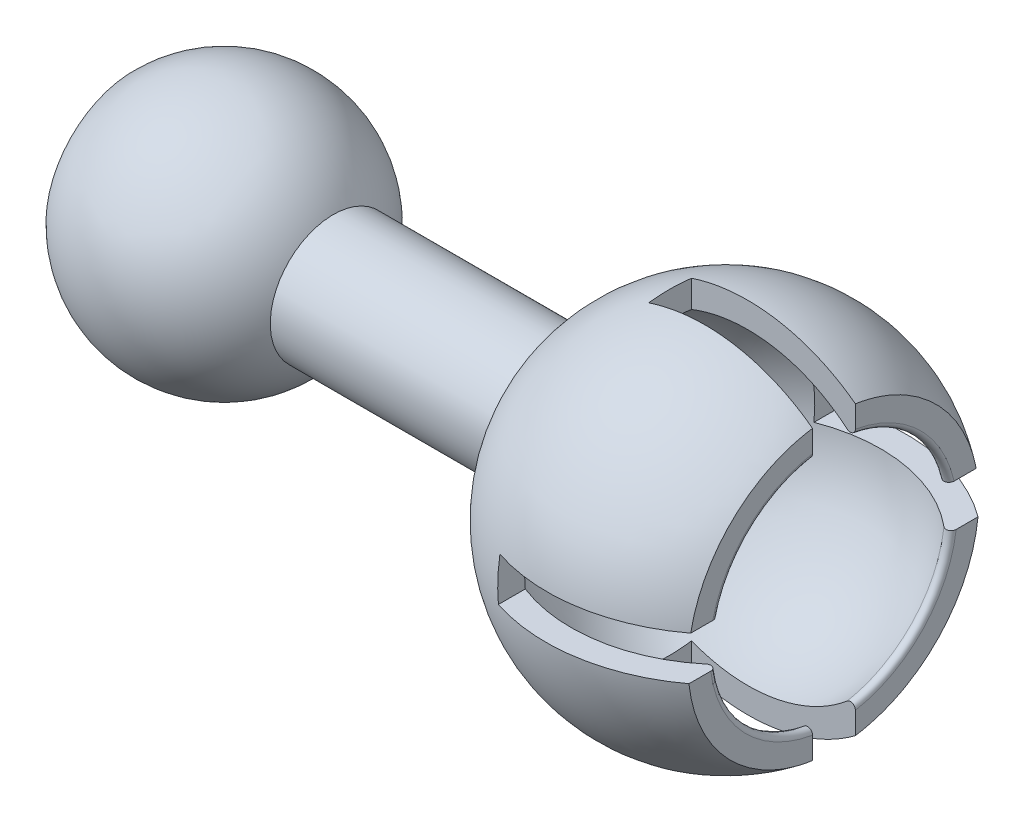
from build123d import *
from build123d.topology import SkipClean

# Parameters (mm, degrees)
SKETCH1_R           = 2.5
BOSS_EXTRUDE1_DEPTH = 9.1
SKETCH3_W           = 6
SKETCH3_H           = 11.05179945
CUT_EXTRUDE1_DEPTH  = 12.603447763
SKETCH5_W           = 2.612485444
SKETCH5_H           = 8.6
CUT_EXTRUDE2_DEPTH  = 12.603447763
SKETCH7_W           = 6.058370448
SKETCH7_H           = 19.821027014
CUT_EXTRUDE3_DEPTH  = 26.087084683
SKETCH8_W           = 5.087357921
SKETCH8_H           = 11.986300625
CUT_EXTRUDE4_DEPTH  = 26.087084683
SKETCH13_W          = 6.5
SKETCH13_H          = 1.7
CUT_EXTRUDE7_DEPTH  = 23.46963891
SKETCH14_W          = 6.5
SKETCH14_H          = 1.7
CUT_EXTRUDE12_DEPTH = 23.453824629
SKETCH15_W          = 6.5
SKETCH15_H          = 1.7
CUT_EXTRUDE13_DEPTH = 25.957574976
SKETCH16_W          = 6.5
SKETCH16_H          = 1.7
CUT_EXTRUDE14_DEPTH = 25.957574976
FILLET2_R           = 0.2


# Read off the part's stored shape, not the designer's step: Shell5
with BuildPart() as part:
    # Sketch1 → Boss-Extrude1 (new body)
    with BuildSketch(Plane(origin=(0, 0, 0), x_dir=(0, 0, -1), z_dir=(1, 0, 0))):
        Circle(SKETCH1_R)
    extrude(amount=BOSS_EXTRUDE1_DEPTH)


with BuildPart() as body_2:
    # Sketch2 → Revolve1 (revolve)
    with BuildSketch(Plane.XY):
        with BuildLine():
            Line((-4.2, -5), (-4.2, 5))
            ThreePointArc((-4.2, 5), (0.8, 0), (-4.2, -5))
        make_face()
    revolve(axis=Axis((-4.2, -5, 0), (0, 1, 0)))

    # Sketch3 → Cut-Extrude1 (cut, through all)
    with BuildSketch(Plane.XY):
        with Locations((-10.8, -0.222974901)):
            Rectangle(SKETCH3_W, SKETCH3_H)
    extrude(amount=CUT_EXTRUDE1_DEPTH, mode=Mode.SUBTRACT)

    # Sketch5 → Cut-Extrude2 (cut, through all)
    with SkipClean():  # the faces are left unmerged after this step: merging them gives an invalid solid
        with BuildSketch(Plane.XY):
            with Locations((-9.106242722, 0.044087756)):
                Rectangle(SKETCH5_W, SKETCH5_H)
        extrude(amount=-CUT_EXTRUDE2_DEPTH, mode=Mode.SUBTRACT)


with BuildPart() as body_3:
    # Sketch6 → Revolve2 (revolve)
    with BuildSketch(Plane.XY):
        with BuildLine():
            Line((15.818514565, -7.389695207), (15.581485435, 6.958130883))
            ThreePointArc((15.581485435, 6.958130883), (22.873913045, -0.097267597), (15.818514565, -7.389695207))
        make_face()
    revolve(axis=Axis((15.818514565, -7.389695207, 0), (-0.01651795827512057, 0.9998635692205319, 0)))

    # Sketch7 → Cut-Extrude3 (cut, through all)
    with BuildSketch(Plane.XY):
        with Locations((22.998750444, 1.552701697)):
            Rectangle(SKETCH7_W, SKETCH7_H)
    extrude(amount=-CUT_EXTRUDE3_DEPTH, mode=Mode.SUBTRACT)

    # Sketch8 → Cut-Extrude4 (cut, through all)
    with BuildSketch(Plane(origin=(0, 0, 0), x_dir=(-1, 0, 0), z_dir=(0, 0, -1))):
        with Locations((-22.513244181, -0.442660984)):
            Rectangle(SKETCH8_W, SKETCH8_H)
    extrude(amount=-CUT_EXTRUDE4_DEPTH, mode=Mode.SUBTRACT)

    # Shell5 outline → Shell5 (revolve, cut)
    with BuildSketch(Plane(origin=(0, -0.215782162, 0), x_dir=(0, 1, 0), z_dir=(0, 0, -1))):
        with BuildLine():
            Line((0, 19.969565224), (0, 9.525108079))
            ThreePointArc((0, 9.525108079), (5.678617528, 13.274594216), (4.460953153, 19.969565224))
            Line((4.460953153, 19.969565224), (0, 19.969565224))
        make_face()
    revolve(axis=Axis((0, -0.215782162, 0), (1, 0, 0)), mode=Mode.SUBTRACT)

    # Sketch13 → Cut-Extrude7 (cut, through all)
    with BuildSketch(Plane(origin=(0, 0, 0), x_dir=(1, 0, 0), z_dir=(0, 1, 0))):
        with Locations((16.71956522, 0.019565)):
            Rectangle(SKETCH13_W, SKETCH13_H)
    extrude(amount=-CUT_EXTRUDE7_DEPTH, mode=Mode.SUBTRACT)

    # Sketch14 → Cut-Extrude12 (cut, through all)
    with BuildSketch(Plane(origin=(0, 0, 0), x_dir=(1, 0, 0), z_dir=(0, 1, 0))):
        with Locations((16.71956522, 0.019565)):
            Rectangle(SKETCH14_W, SKETCH14_H)
    extrude(amount=CUT_EXTRUDE12_DEPTH, mode=Mode.SUBTRACT)

    # Sketch15 → Cut-Extrude13 (cut, through all)
    with BuildSketch(Plane.XY):
        with Locations((16.71956522, 0.019565217)):
            Rectangle(SKETCH15_W, SKETCH15_H)
    extrude(amount=-CUT_EXTRUDE13_DEPTH, mode=Mode.SUBTRACT)

    # Sketch16 → Cut-Extrude14 (cut, through all)
    with BuildSketch(Plane.XY):
        with Locations((16.71956522, 0.019565)):
            Rectangle(SKETCH16_W, SKETCH16_H)
    extrude(amount=CUT_EXTRUDE14_DEPTH, mode=Mode.SUBTRACT)

    # Fillet2
    fillet2_edges = [body_3.edges().sort_by_distance(p)[0] for p in [
        (19.969565224, -3.291892812, 3.230734638),
        (19.969565224, -3.277428117, -3.244445573),
        (19.969565224, 3.029517424, 3.060740699),
        (19.969565224, 3.015810678, -3.075209058),
    ]]
    fillet(fillet2_edges, radius=FILLET2_R)


solid = Compound([part.part, body_2.part, body_3.part])
